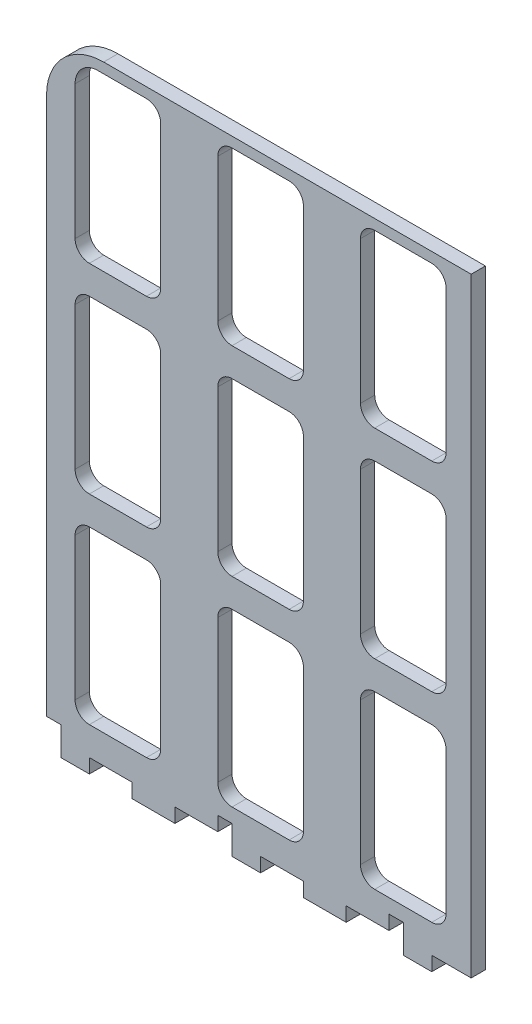
from build123d import *

# Parameters (mm, degrees)
BOSS_EXTRUDE1_DEPTH = 6.35
CUT_EXTRUDE1_DEPTH  = 331.667127275
SKETCH3_W           = 6.35
SKETCH3_H           = 12.7
CUT_EXTRUDE2_DEPTH  = 331.667127275


with BuildPart() as part:
    # Sketch1 → Boss-Extrude1 (new body)
    with BuildSketch(Plane.XY):
        with BuildLine():
            Line((171.45, 0), (188.976, 0))
            Line((188.976, 0), (188.976, 271.272))
            Line((188.976, 271.272), (25.4, 271.272))
            ThreePointArc((25.4, 271.272), (7.439487758, 263.832512242), (0, 245.872))
            Line((0, 245.872), (0, 0))
            Line((0, 0), (0, -6.35))
            Line((0, -6.35), (19.05, -6.35))
            Line((19.05, -6.35), (19.05, 0))
            Line((19.05, 0), (38.1, 0))
            Line((38.1, 0), (38.1, -6.35))
            Line((38.1, -6.35), (57.15, -6.35))
            Line((57.15, -6.35), (57.15, 0))
            Line((57.15, 0), (76.2, 0))
            Line((76.2, 0), (76.2, -6.35))
            Line((76.2, -6.35), (95.25, -6.35))
            Line((95.25, -6.35), (95.25, 0))
            Line((95.25, 0), (114.3, 0))
            Line((114.3, 0), (114.3, -6.35))
            Line((114.3, -6.35), (133.35, -6.35))
            Line((133.35, -6.35), (133.35, 0))
            Line((133.35, 0), (152.4, 0))
            Line((152.4, 0), (152.4, -6.35))
            Line((152.4, -6.35), (171.45, -6.35))
            Line((171.45, -6.35), (171.45, 0))
        make_face()
    extrude(amount=BOSS_EXTRUDE1_DEPTH)

    # Sketch2 → Cut-Extrude1 (cut, through all)
    with BuildSketch(Plane.XY.offset(6.35)):
        with BuildLine():
            Line((44.45, 266.7), (22.86, 266.7))
            ThreePointArc((22.86, 266.7), (15.675795103, 263.724204897), (12.7, 256.54))
            Line((12.7, 256.54), (12.7, 196.85))
            ThreePointArc((12.7, 196.85), (14.559871939, 192.359871939), (19.05, 190.5))
            Line((19.05, 190.5), (44.45, 190.5))
            ThreePointArc((44.45, 190.5), (48.940128061, 192.359871939), (50.8, 196.85))
            Line((50.8, 196.85), (50.8, 260.35))
            ThreePointArc((50.8, 260.35), (48.940128061, 264.840128061), (44.45, 266.7))
        make_face()
        with BuildLine():
            Line((76.2, 19.05), (76.2, 82.55))
            ThreePointArc((76.2, 82.55), (78.059871939, 87.040128061), (82.55, 88.9))
            Line((82.55, 88.9), (107.95, 88.9))
            ThreePointArc((107.95, 88.9), (112.440128061, 87.040128061), (114.3, 82.55))
            Line((114.3, 82.55), (114.3, 19.05))
            ThreePointArc((114.3, 19.05), (112.440128061, 14.559871939), (107.95, 12.7))
            Line((107.95, 12.7), (82.55, 12.7))
            ThreePointArc((82.55, 12.7), (78.059871939, 14.559871939), (76.2, 19.05))
        make_face()
        with BuildLine():
            Line((19.05, 12.7), (44.45, 12.7))
            ThreePointArc((44.45, 12.7), (48.940128061, 14.559871939), (50.8, 19.05))
            Line((50.8, 19.05), (50.8, 82.55))
            ThreePointArc((50.8, 82.55), (48.940128061, 87.040128061), (44.45, 88.9))
            Line((44.45, 88.9), (19.05, 88.9))
            ThreePointArc((19.05, 88.9), (14.559871939, 87.040128061), (12.7, 82.55))
            Line((12.7, 82.55), (12.7, 19.05))
            ThreePointArc((12.7, 19.05), (14.559871939, 14.559871939), (19.05, 12.7))
        make_face()
        with BuildLine():
            Line((139.7, 19.05), (139.7, 82.55))
            ThreePointArc((139.7, 82.55), (141.559871939, 87.040128061), (146.05, 88.9))
            Line((146.05, 88.9), (171.45, 88.9))
            ThreePointArc((171.45, 88.9), (175.940128061, 87.040128061), (177.8, 82.55))
            Line((177.8, 82.55), (177.8, 19.05))
            ThreePointArc((177.8, 19.05), (175.940128061, 14.559871939), (171.45, 12.7))
            Line((171.45, 12.7), (146.05, 12.7))
            ThreePointArc((146.05, 12.7), (141.559871939, 14.559871939), (139.7, 19.05))
        make_face()
        with BuildLine():
            Line((76.2, 107.95), (76.2, 171.45))
            ThreePointArc((76.2, 171.45), (78.059871939, 175.940128061), (82.55, 177.8))
            Line((82.55, 177.8), (107.95, 177.8))
            ThreePointArc((107.95, 177.8), (112.440128061, 175.940128061), (114.3, 171.45))
            Line((114.3, 171.45), (114.3, 107.95))
            ThreePointArc((114.3, 107.95), (112.440128061, 103.459871939), (107.95, 101.6))
            Line((107.95, 101.6), (82.55, 101.6))
            ThreePointArc((82.55, 101.6), (78.059871939, 103.459871939), (76.2, 107.95))
        make_face()
        with BuildLine():
            Line((139.7, 107.95), (139.7, 171.45))
            ThreePointArc((139.7, 171.45), (141.559871939, 175.940128061), (146.05, 177.8))
            Line((146.05, 177.8), (171.45, 177.8))
            ThreePointArc((171.45, 177.8), (175.940128061, 175.940128061), (177.8, 171.45))
            Line((177.8, 171.45), (177.8, 107.95))
            ThreePointArc((177.8, 107.95), (175.940128061, 103.459871939), (171.45, 101.6))
            Line((171.45, 101.6), (146.05, 101.6))
            ThreePointArc((146.05, 101.6), (141.559871939, 103.459871939), (139.7, 107.95))
        make_face()
        with BuildLine():
            Line((76.2, 196.85), (76.2, 260.35))
            ThreePointArc((76.2, 260.35), (78.059871939, 264.840128061), (82.55, 266.7))
            Line((82.55, 266.7), (107.95, 266.7))
            ThreePointArc((107.95, 266.7), (112.440128061, 264.840128061), (114.3, 260.35))
            Line((114.3, 260.35), (114.3, 196.85))
            ThreePointArc((114.3, 196.85), (112.440128061, 192.359871939), (107.95, 190.5))
            Line((107.95, 190.5), (82.55, 190.5))
            ThreePointArc((82.55, 190.5), (78.059871939, 192.359871939), (76.2, 196.85))
        make_face()
        with BuildLine():
            Line((139.7, 196.85), (139.7, 260.35))
            ThreePointArc((139.7, 260.35), (141.559871939, 264.840128061), (146.05, 266.7))
            Line((146.05, 266.7), (171.45, 266.7))
            ThreePointArc((171.45, 266.7), (175.940128061, 264.840128061), (177.8, 260.35))
            Line((177.8, 260.35), (177.8, 196.85))
            ThreePointArc((177.8, 196.85), (175.940128061, 192.359871939), (171.45, 190.5))
            Line((171.45, 190.5), (146.05, 190.5))
            ThreePointArc((146.05, 190.5), (141.559871939, 192.359871939), (139.7, 196.85))
        make_face()
        with BuildLine():
            Line((12.7, 107.95), (12.7, 171.45))
            ThreePointArc((12.7, 171.45), (14.559871939, 175.940128061), (19.05, 177.8))
            Line((19.05, 177.8), (44.45, 177.8))
            ThreePointArc((44.45, 177.8), (48.940128061, 175.940128061), (50.8, 171.45))
            Line((50.8, 171.45), (50.8, 107.95))
            ThreePointArc((50.8, 107.95), (48.940128061, 103.459871939), (44.45, 101.6))
            Line((44.45, 101.6), (19.05, 101.6))
            ThreePointArc((19.05, 101.6), (14.559871939, 103.459871939), (12.7, 107.95))
        make_face()
    extrude(amount=-CUT_EXTRUDE1_DEPTH, mode=Mode.SUBTRACT)

    # Sketch3 → Cut-Extrude2 (cut, through all)
    with BuildSketch(Plane.XY.offset(6.35)):
        with Locations((3.175, 0)):
            Rectangle(SKETCH3_W, SKETCH3_H)
        with Locations((79.375, 0)):
            Rectangle(SKETCH3_W, SKETCH3_H)
        with Locations((155.575, 0)):
            Rectangle(SKETCH3_W, SKETCH3_H)
    extrude(amount=-CUT_EXTRUDE2_DEPTH, mode=Mode.SUBTRACT)


solid = part.part
